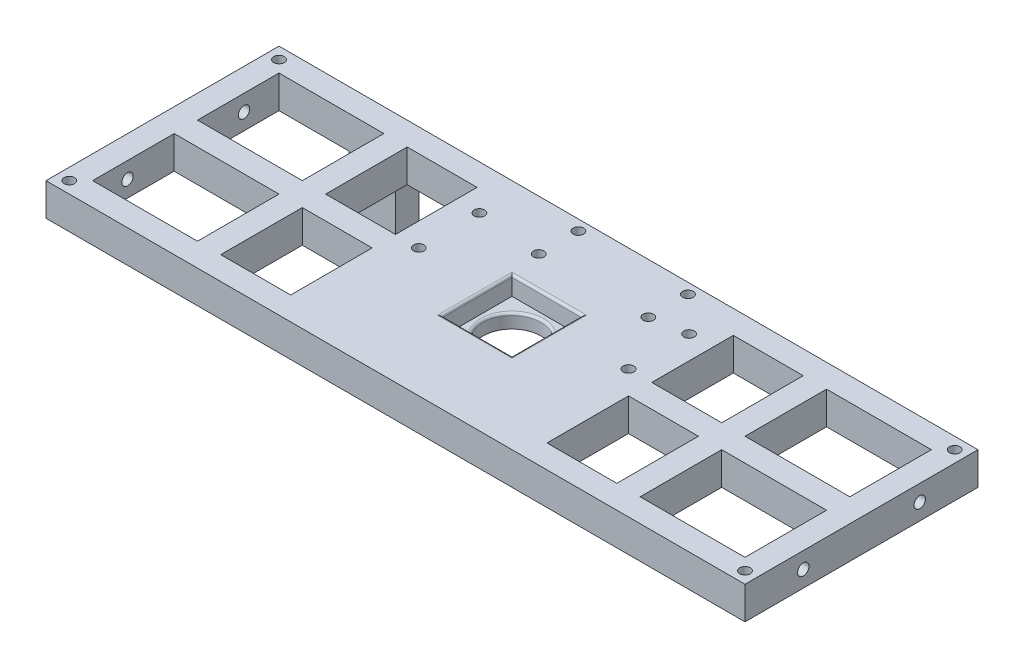
from build123d import *

# Parameters (mm, degrees)
SKETCH_1_W           = 300
SKETCH_1_H           = 100
EXTRUDE_1_DEPTH      = 16
SKETCH_2_W           = 30
SKETCH_2_H           = 30
CUT_EXTRUDE_1_DEPTH  = 8
SKETCH_3_R           = 12.5
CUT_EXTRUDE_2_DEPTH  = 14
CUT_EXTRUDE_3_REACH  = 318.632
SKETCH_4_W           = 50
SKETCH_4_H           = 35
SKETCH_7_W           = 35
SKETCH_7_H           = 16
EXTRUDE_2_DEPTH      = 20
SKETCH_8_W           = 35
SKETCH_8_H           = 16
EXTRUDE_3_DEPTH      = 20
SKETCH_9_W           = 20
SKETCH_9_H           = 10
EXTRUDE_4_DEPTH      = 25
FILLET_1_R           = 1
FILLET_2_R           = 1
SKETCH_13_W          = 35
SKETCH_13_H          = 16
EXTRUDE_6_DEPTH      = 4
SKETCH_14_W          = 35
SKETCH_14_H          = 16
EXTRUDE_7_DEPTH      = 4
SKETCH_17_W          = 35
SKETCH_17_H          = 16
EXTRUDE_8_DEPTH      = 1
SKETCH_18_W          = 35
SKETCH_18_H          = 16
EXTRUDE_9_DEPTH      = 1
SKETCH_19_R          = 2.25
CUT_EXTRUDE_8_DEPTH  = 5
CUT_EXTRUDE_15_DEPTH = 2
SKETCH_28_R          = 2.25
CUT_EXTRUDE_18_DEPTH = 5
SKETCH_30_R          = 1.5
CUT_EXTRUDE_20_DEPTH = 4
SKETCH_33_R          = 2.45
CUT_EXTRUDE_22_DEPTH = 13.2
CUT_EXTRUDE_START    = -13.2
SKETCH_34_R          = 2.45
CUT_EXTRUDE_23_DEPTH = 13.2


with BuildPart() as part:
    # 草图1 → 凸台-拉伸1 (new body)
    with BuildSketch(Plane(origin=(0, 0, 0), x_dir=(1, 0, 0), z_dir=(0, 1, 0))):
        with Locations((-150, 50)):
            Rectangle(SKETCH_1_W, SKETCH_1_H)
    extrude(amount=EXTRUDE_1_DEPTH)

    # 草图2 → 切除-拉伸1 (cut)
    with BuildSketch(Plane(origin=(0, 16, 0), x_dir=(1, 0, 0), z_dir=(0, 1, 0))):
        with Locations((-150, 50)):
            Rectangle(SKETCH_2_W, SKETCH_2_H)
    extrude(amount=-CUT_EXTRUDE_1_DEPTH, mode=Mode.SUBTRACT)

    # 草图3 → 切除-拉伸2 (cut)
    with BuildSketch(Plane(origin=(0, 8, 0), x_dir=(1, 0, 0), z_dir=(0, 1, 0))):
        with Locations((-150, 50)):
            Circle(SKETCH_3_R)
    extrude(amount=-CUT_EXTRUDE_2_DEPTH, mode=Mode.SUBTRACT)

    # 草图4 → 切除-拉伸3 (cut, up to next)
    with BuildSketch(Plane(origin=(0, 16, 0), x_dir=(1, 0, 0), z_dir=(0, 1, 0)), mode=Mode.PRIVATE) as cut_extrude_3_sk1:
        with Locations((-270, 72.5)):
            Rectangle(SKETCH_4_W, SKETCH_4_H)
    cut_extrude_3_tool1 = extrude(cut_extrude_3_sk1.sketch, amount=-CUT_EXTRUDE_3_REACH, mode=Mode.PRIVATE) & part.part
    # 草图4 → 切除-拉伸3 (cut, up to next)
    with BuildSketch(Plane(origin=(0, 16, 0), x_dir=(1, 0, 0), z_dir=(0, 1, 0)), mode=Mode.PRIVATE) as cut_extrude_3_sk2:
        with Locations((-270, 27.5)):
            Rectangle(SKETCH_4_W, SKETCH_4_H)
    cut_extrude_3_tool2 = extrude(cut_extrude_3_sk2.sketch, amount=-CUT_EXTRUDE_3_REACH, mode=Mode.PRIVATE) & part.part
    # 草图4 → 切除-拉伸3 (cut, up to next)
    with BuildSketch(Plane(origin=(0, 16, 0), x_dir=(1, 0, 0), z_dir=(0, 1, 0)), mode=Mode.PRIVATE) as cut_extrude_3_sk3:
        with Locations((-210, 72.5)):
            Rectangle(SKETCH_4_W, SKETCH_4_H)
    cut_extrude_3_tool3 = extrude(cut_extrude_3_sk3.sketch, amount=-CUT_EXTRUDE_3_REACH, mode=Mode.PRIVATE) & part.part
    # 草图4 → 切除-拉伸3 (cut, up to next)
    with BuildSketch(Plane(origin=(0, 16, 0), x_dir=(1, 0, 0), z_dir=(0, 1, 0)), mode=Mode.PRIVATE) as cut_extrude_3_sk4:
        with Locations((-210, 27.5)):
            Rectangle(SKETCH_4_W, SKETCH_4_H)
    cut_extrude_3_tool4 = extrude(cut_extrude_3_sk4.sketch, amount=-CUT_EXTRUDE_3_REACH, mode=Mode.PRIVATE) & part.part
    # 草图4 → 切除-拉伸3 (cut, up to next)
    with BuildSketch(Plane(origin=(0, 16, 0), x_dir=(1, 0, 0), z_dir=(0, 1, 0)), mode=Mode.PRIVATE) as cut_extrude_3_sk5:
        with Locations((-30, 27.5)):
            Rectangle(SKETCH_4_W, SKETCH_4_H)
    cut_extrude_3_tool5 = extrude(cut_extrude_3_sk5.sketch, amount=-CUT_EXTRUDE_3_REACH, mode=Mode.PRIVATE) & part.part
    # 草图4 → 切除-拉伸3 (cut, up to next)
    with BuildSketch(Plane(origin=(0, 16, 0), x_dir=(1, 0, 0), z_dir=(0, 1, 0)), mode=Mode.PRIVATE) as cut_extrude_3_sk6:
        with Locations((-90, 27.5)):
            Rectangle(SKETCH_4_W, SKETCH_4_H)
    cut_extrude_3_tool6 = extrude(cut_extrude_3_sk6.sketch, amount=-CUT_EXTRUDE_3_REACH, mode=Mode.PRIVATE) & part.part
    # 草图4 → 切除-拉伸3 (cut, up to next)
    with BuildSketch(Plane(origin=(0, 16, 0), x_dir=(1, 0, 0), z_dir=(0, 1, 0)), mode=Mode.PRIVATE) as cut_extrude_3_sk7:
        with Locations((-90, 72.5)):
            Rectangle(SKETCH_4_W, SKETCH_4_H)
    cut_extrude_3_tool7 = extrude(cut_extrude_3_sk7.sketch, amount=-CUT_EXTRUDE_3_REACH, mode=Mode.PRIVATE) & part.part
    # 草图4 → 切除-拉伸3 (cut, up to next)
    with BuildSketch(Plane(origin=(0, 16, 0), x_dir=(1, 0, 0), z_dir=(0, 1, 0)), mode=Mode.PRIVATE) as cut_extrude_3_sk8:
        with Locations((-30, 72.5)):
            Rectangle(SKETCH_4_W, SKETCH_4_H)
    cut_extrude_3_tool8 = extrude(cut_extrude_3_sk8.sketch, amount=-CUT_EXTRUDE_3_REACH, mode=Mode.PRIVATE) & part.part
    add(cut_extrude_3_tool1.solids().sort_by_distance((-270, 16, -72.5))[0], mode=Mode.SUBTRACT)
    add(cut_extrude_3_tool2.solids().sort_by_distance((-270, 16, -27.5))[0], mode=Mode.SUBTRACT)
    add(cut_extrude_3_tool3.solids().sort_by_distance((-210, 16, -72.5))[0], mode=Mode.SUBTRACT)
    add(cut_extrude_3_tool4.solids().sort_by_distance((-210, 16, -27.5))[0], mode=Mode.SUBTRACT)
    add(cut_extrude_3_tool5.solids().sort_by_distance((-30, 16, -27.5))[0], mode=Mode.SUBTRACT)
    add(cut_extrude_3_tool6.solids().sort_by_distance((-90, 16, -27.5))[0], mode=Mode.SUBTRACT)
    add(cut_extrude_3_tool7.solids().sort_by_distance((-90, 16, -72.5))[0], mode=Mode.SUBTRACT)
    add(cut_extrude_3_tool8.solids().sort_by_distance((-30, 16, -72.5))[0], mode=Mode.SUBTRACT)

    # 草图7 → 凸台-拉伸2 (add)
    with BuildSketch(Plane.ZY.offset(185)):
        with Locations((-27.5, 8)):
            Rectangle(SKETCH_7_W, SKETCH_7_H)
        with Locations((-72.5, 8)):
            Rectangle(SKETCH_7_W, SKETCH_7_H)
    extrude(amount=EXTRUDE_2_DEPTH)

    # 草图8 → 凸台-拉伸3 (add)
    with BuildSketch(Plane(origin=(-115, 0, 0), x_dir=(0, 0, -1), z_dir=(1, 0, 0))):
        with Locations((27.5, 8)):
            Rectangle(SKETCH_8_W, SKETCH_8_H)
        with Locations((72.5, 8)):
            Rectangle(SKETCH_8_W, SKETCH_8_H)
    extrude(amount=EXTRUDE_3_DEPTH)

    # 草图9 → 凸台-拉伸4 (add)
    with BuildSketch(Plane.XZ):
        with Locations((-250, -95)):
            Rectangle(SKETCH_9_W, SKETCH_9_H)
    extrude(amount=EXTRUDE_4_DEPTH)

    # 圆角1
    fillet_1_edges = [part.edges().sort_by_distance(p)[0] for p in [
        (-162.5, 8, -50),
    ]]
    fillet(fillet_1_edges, radius=FILLET_1_R)

    # 圆角2
    fillet_2_edges = [part.edges().sort_by_distance(p)[0] for p in [
        (-135, 16, -50),
        (-150, 16, -65),
        (-150, 16, -35),
        (-165, 16, -50),
    ]]
    fillet(fillet_2_edges, radius=FILLET_2_R)

    # 草图13 → 凸台-拉伸6 (add)
    with BuildSketch(Plane.ZY.offset(5)):
        with Locations((-72.5, 8)):
            Rectangle(SKETCH_13_W, SKETCH_13_H)
        with Locations((-27.5, 8)):
            Rectangle(SKETCH_13_W, SKETCH_13_H)
    extrude(amount=EXTRUDE_6_DEPTH)

    # 草图14 → 凸台-拉伸7 (add)
    with BuildSketch(Plane(origin=(-295, 0, 0), x_dir=(0, 0, -1), z_dir=(1, 0, 0))):
        with Locations((72.5, 8)):
            Rectangle(SKETCH_14_W, SKETCH_14_H)
        with Locations((27.5, 8)):
            Rectangle(SKETCH_14_W, SKETCH_14_H)
    extrude(amount=EXTRUDE_7_DEPTH)

    # 草图17 → 凸台-拉伸8 (add)
    with BuildSketch(Plane(origin=(-291, 0, 0), x_dir=(0, 0, -1), z_dir=(1, 0, 0))):
        with Locations((27.5, 8)):
            Rectangle(SKETCH_17_W, SKETCH_17_H)
        with Locations((72.5, 8)):
            Rectangle(SKETCH_17_W, SKETCH_17_H)
    extrude(amount=EXTRUDE_8_DEPTH)

    # 草图18 → 凸台-拉伸9 (add)
    with BuildSketch(Plane.ZY.offset(9)):
        with Locations((-27.5, 8)):
            Rectangle(SKETCH_18_W, SKETCH_18_H)
        with Locations((-72.5, 8)):
            Rectangle(SKETCH_18_W, SKETCH_18_H)
    extrude(amount=EXTRUDE_9_DEPTH)

    # 草图19 → 切除-拉伸8 (cut)
    with BuildSketch(Plane(origin=(0, 16, 0), x_dir=(1, 0, 0), z_dir=(0, 1, 0))):
        with Locations((-295, 95)):
            Circle(SKETCH_19_R)
        with Locations((-295, 5)):
            Circle(SKETCH_19_R)
        with Locations((-5, 5)):
            Circle(SKETCH_19_R)
        with Locations((-5, 95)):
            Circle(SKETCH_19_R)
    extrude(amount=-CUT_EXTRUDE_8_DEPTH, mode=Mode.SUBTRACT)

    # 草图26 → 切除-拉伸15 (cut)
    with BuildSketch(Plane.XZ):
        Polygon((-260, -90), (-290, -90), (-290, -55), (-245, -55), (-245, -90), (-240, -90), (-240, -100), (0, -100), (0, 0), (-300, 0), (-300, -100), (-260, -100), align=None)
    extrude(amount=-CUT_EXTRUDE_15_DEPTH, mode=Mode.SUBTRACT)

    # 草图28 → 切除-拉伸18 (cut)
    with BuildSketch(Plane(origin=(0, 16, 0), x_dir=(1, 0, 0), z_dir=(0, 1, 0))):
        with Locations((-105.002761288, 55.000000147)):
            Circle(SKETCH_28_R)
        with Locations((-105, 81)):
            Circle(SKETCH_28_R)
        with Locations((-120, 78.499971194)):
            Circle(SKETCH_28_R)
        with Locations((-120, 95.5)):
            Circle(SKETCH_28_R)
        with Locations((-167.000079641, 78.5)):
            Circle(SKETCH_28_R)
        with Locations((-167.000079641, 95.5)):
            Circle(SKETCH_28_R)
        with Locations((-195, 54.99995086)):
            Circle(SKETCH_28_R)
        with Locations((-195, 81)):
            Circle(SKETCH_28_R)
    extrude(amount=-CUT_EXTRUDE_18_DEPTH, mode=Mode.SUBTRACT)

    # 草图30 → 切除-拉伸20 (cut)
    with BuildSketch(Plane(origin=(0, 11, 0), x_dir=(1, 0, 0), z_dir=(0, 1, 0))):
        with Locations((-195, 81)):
            Circle(SKETCH_30_R)
        with Locations((-195, 54.99995086)):
            Circle(SKETCH_30_R)
        with Locations((-167.000079641, 95.5)):
            Circle(SKETCH_30_R)
        with Locations((-167.000079641, 78.5)):
            Circle(SKETCH_30_R)
        with Locations((-120, 95.5)):
            Circle(SKETCH_30_R)
        with Locations((-120, 78.499971194)):
            Circle(SKETCH_30_R)
        with Locations((-105, 81)):
            Circle(SKETCH_30_R)
        with Locations((-105.002761288, 55.000000147)):
            Circle(SKETCH_30_R)
    extrude(amount=-CUT_EXTRUDE_20_DEPTH, mode=Mode.SUBTRACT)

    # 草图33 → 切除-拉伸22 (cut)
    with BuildSketch(Plane.ZY.offset(300)):
        with Locations((-75, 9)):
            Circle(SKETCH_33_R)
        with Locations((-25, 9)):
            Circle(SKETCH_33_R)
    extrude(amount=-CUT_EXTRUDE_22_DEPTH, mode=Mode.SUBTRACT)

    # 草图34 → 切除-拉伸23 (cut)
    with BuildSketch(Plane(origin=(0, 0, 0), x_dir=(0, 0, -1), z_dir=(1, 0, 0)).offset(CUT_EXTRUDE_START)):
        with Locations((75, 9)):
            Circle(SKETCH_34_R)
        with Locations((25, 9)):
            Circle(SKETCH_34_R)
    extrude(amount=CUT_EXTRUDE_23_DEPTH, mode=Mode.SUBTRACT)


solid = part.part
